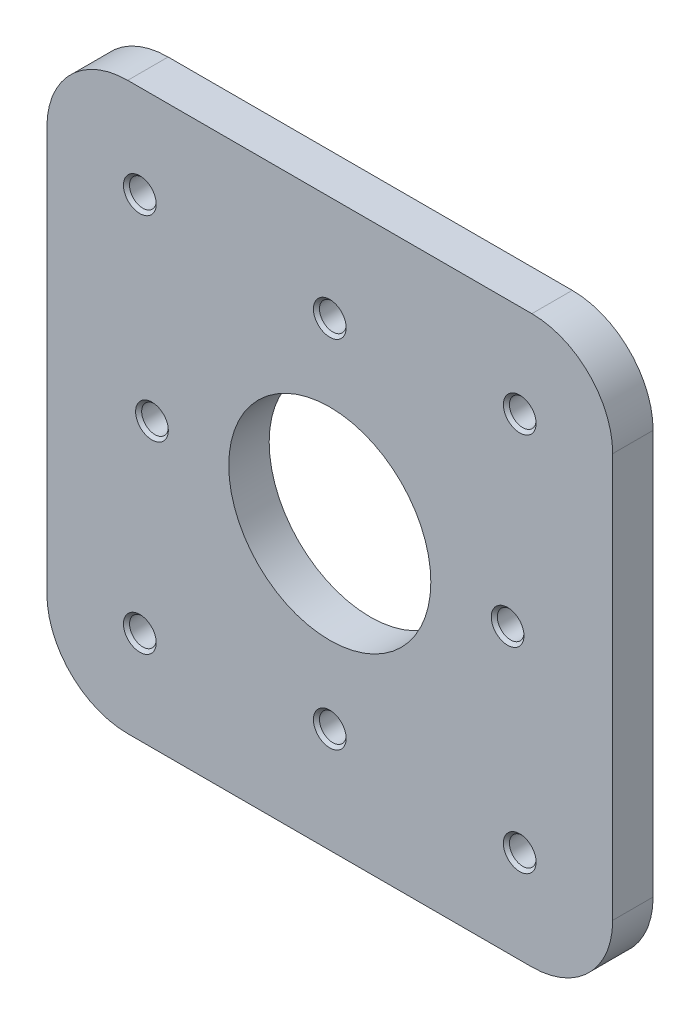
from build123d import *

# Parameters (mm, degrees)
SKETCH1_W                       = 70
SKETCH1_H                       = 70
SKETCH1_R                       = 12.5
BASE_FLANGE1_DEPTH              = 5
M4X0_7_TAPPED_HOLE1_D           = 3.3
M4X0_7_TAPPED_HOLE1_DEPTH       = 10.1
M4X0_7_TAPPED_HOLE1_CSINK_D     = 4.05
M4X0_7_TAPPED_HOLE1_CSINK_ANGLE = 90
M4X0_7_TAPPED_HOLE1_TIP         = 0.991420021
M4X0_7_TAPPED_HOLE2_D           = 3.3
M4X0_7_TAPPED_HOLE2_DEPTH       = 10.1
M4X0_7_TAPPED_HOLE2_CSINK_D     = 4.05
M4X0_7_TAPPED_HOLE2_CSINK_ANGLE = 90
M4X0_7_TAPPED_HOLE2_TIP         = 0.991420021
FILLET1_R                       = 10


# Sheet-metal steps are written as plain solids
with BuildPart() as part:
    # Sketch1 → Base-Flange1 (new body)
    with BuildSketch(Plane.XY):
        Rectangle(SKETCH1_W, SKETCH1_H)
        Circle(SKETCH1_R, mode=Mode.SUBTRACT)
    extrude(amount=-BASE_FLANGE1_DEPTH)

    # M4x0.7 Tapped Hole1
    with Locations(Plane.XY):
        with Locations((0, 22), (-22, 0), (0, -22), (22, 0)):
            CounterSinkHole(M4X0_7_TAPPED_HOLE1_D / 2, M4X0_7_TAPPED_HOLE1_CSINK_D / 2, depth=M4X0_7_TAPPED_HOLE1_DEPTH, counter_sink_angle=M4X0_7_TAPPED_HOLE1_CSINK_ANGLE)
            with Locations((0, 0, -(M4X0_7_TAPPED_HOLE1_DEPTH + M4X0_7_TAPPED_HOLE1_TIP / 2))):  # 118° drill point
                Cone(0, M4X0_7_TAPPED_HOLE1_D / 2, M4X0_7_TAPPED_HOLE1_TIP, mode=Mode.SUBTRACT)

    # M4x0.7 Tapped Hole2
    with Locations(Plane.XY):
        with Locations((-23.5, 23.5), (23.5, 23.5), (23.5, -23.5), (-23.5, -23.5)):
            CounterSinkHole(M4X0_7_TAPPED_HOLE2_D / 2, M4X0_7_TAPPED_HOLE2_CSINK_D / 2, depth=M4X0_7_TAPPED_HOLE2_DEPTH, counter_sink_angle=M4X0_7_TAPPED_HOLE2_CSINK_ANGLE)
            with Locations((0, 0, -(M4X0_7_TAPPED_HOLE2_DEPTH + M4X0_7_TAPPED_HOLE2_TIP / 2))):  # 118° drill point
                Cone(0, M4X0_7_TAPPED_HOLE2_D / 2, M4X0_7_TAPPED_HOLE2_TIP, mode=Mode.SUBTRACT)

    # Fillet1
    fillet1_edges = [part.edges().sort_by_distance(p)[0] for p in [
        (35, -35, -2.5),
        (-35, -35, -2.5),
        (-35, 35, -2.5),
        (35, 35, -2.5),
    ]]
    fillet(fillet1_edges, radius=FILLET1_R)


solid = part.part
